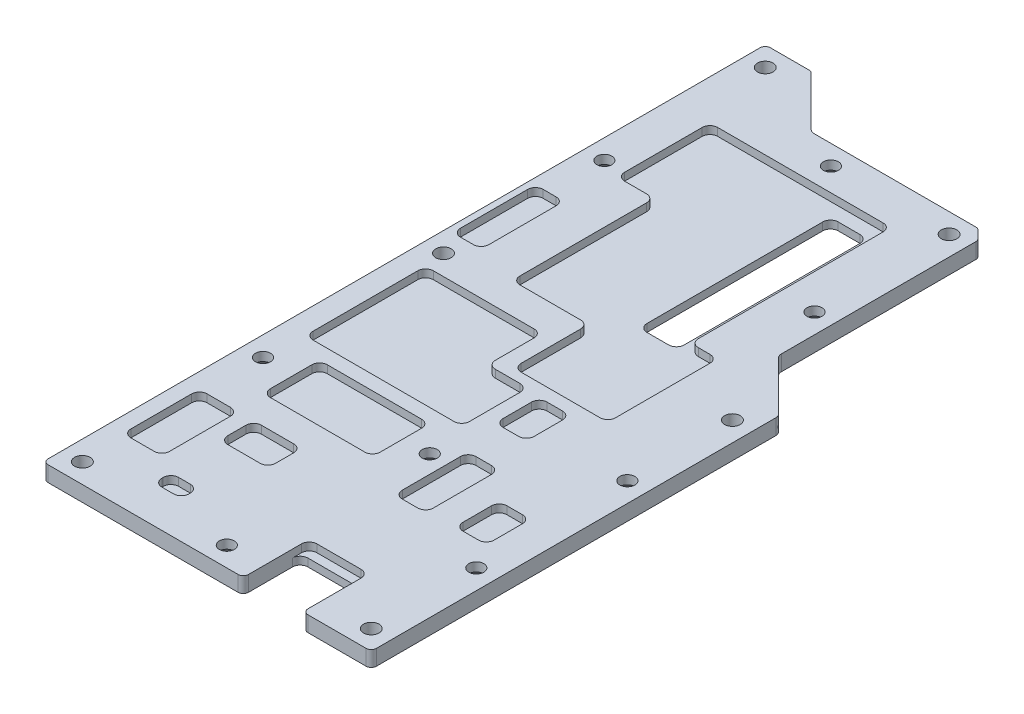
from build123d import *

# Parameters (mm, degrees)
BOSS_EXTRUDE1_DEPTH                                  = 3
CUT_EXTRUDE1_DEPTH                                   = 1.5
CUT_EXTRUDE2_REACH                                   = 155.484
F_3_0MM_DOWEL_HOLE1_D                                = 3
CSK_FOR_M2_5_COUNTERSUNK_RAISED_HEAD_SCR_D           = 2.9
CSK_FOR_M2_5_COUNTERSUNK_RAISED_HEAD_SCR_CSINK_D     = 5.5
CSK_FOR_M2_5_COUNTERSUNK_RAISED_HEAD_SCR_CSINK_ANGLE = 90


with BuildPart() as part:
    # Sketch1 → Boss-Extrude1 (new body)
    with BuildSketch(Plane(origin=(0, 0, 0), x_dir=(1, 0, 0), z_dir=(0, 1, 0))):
        with BuildLine():
            Line((0, 1), (0, 138.7))
            ThreePointArc((0, 138.7), (0.292893219, 139.407106781), (1, 139.7))
            Line((1, 139.7), (8.475786438, 139.7))
            ThreePointArc((8.475786438, 139.7), (8.85846987, 139.623879533), (9.182893219, 139.407106781))
            Line((9.182893219, 139.407106781), (18.610660172, 129.979339828))
            ThreePointArc((18.610660172, 129.979339828), (19.097295195, 129.654180701), (19.671320344, 129.54))
            Line((19.671320344, 129.54), (50.895786438, 129.54))
            ThreePointArc((50.895786438, 129.54), (51.27846987, 129.463879533), (51.602893219, 129.247106781))
            Line((51.602893219, 129.247106781), (53.047106781, 127.802893219))
            ThreePointArc((53.047106781, 127.802893219), (53.263879533, 127.47846987), (53.34, 127.095786438))
            Line((53.34, 127.095786438), (53.34, 89.521320344))
            ThreePointArc((53.34, 89.521320344), (53.454180701, 88.947295195), (53.779339828, 88.460660172))
            Line((53.779339828, 88.460660172), (63.207106781, 79.032893219))
            ThreePointArc((63.207106781, 79.032893219), (63.423879533, 78.70846987), (63.5, 78.325786438))
            Line((63.5, 78.325786438), (63.5, 1))
            ThreePointArc((63.5, 1), (63.207106781, 0.292893219), (62.5, 0))
            Line((62.5, 0), (51.25, 0))
            ThreePointArc((51.25, 0), (50.542893219, 0.292893219), (50.25, 1))
            Line((50.25, 1), (50.25, 9.5))
            ThreePointArc((50.25, 9.5), (49.810660172, 10.560660172), (48.75, 11))
            Line((48.75, 11), (40.25, 11))
            ThreePointArc((40.25, 11), (39.189339828, 10.560660172), (38.75, 9.5))
            Line((38.75, 9.5), (38.75, 1))
            ThreePointArc((38.75, 1), (38.457106781, 0.292893219), (37.75, 0))
            Line((37.75, 0), (1, 0))
            ThreePointArc((1, 0), (0.292893219, 0.292893219), (0, 1))
        make_face()
    extrude(amount=BOSS_EXTRUDE1_DEPTH)

    # Sketch2 → Cut-Extrude1 (cut)
    with BuildSketch(Plane(origin=(0, 3, 0), x_dir=(1, 0, 0), z_dir=(0, 1, 0))):
        with BuildLine():
            Line((50.25, 0), (50.25, 11.25))
            ThreePointArc((50.25, 11.25), (49.810660172, 12.310660172), (48.75, 12.75))
            Line((48.75, 12.75), (40.25, 12.75))
            ThreePointArc((40.25, 12.75), (39.189339828, 12.310660172), (38.75, 11.25))
            Line((38.75, 11.25), (38.75, 0))
            Line((38.75, 0), (50.25, 0))
        make_face()
        with BuildLine():
            Line((52.25, 37.5), (55.25, 37.5))
            ThreePointArc((55.25, 37.5), (56.310660172, 37.060660172), (56.75, 36))
            Line((56.75, 36), (56.75, 30.5))
            ThreePointArc((56.75, 30.5), (56.310660172, 29.439339828), (55.25, 29))
            Line((55.25, 29), (52.25, 29))
            ThreePointArc((52.25, 29), (51.189339828, 29.439339828), (50.75, 30.5))
            Line((50.75, 30.5), (50.75, 36))
            ThreePointArc((50.75, 36), (51.189339828, 37.060660172), (52.25, 37.5))
        make_face()
        with BuildLine():
            Line((41, 42.75), (44, 42.75))
            ThreePointArc((44, 42.75), (45.060660172, 42.310660172), (45.5, 41.25))
            Line((45.5, 41.25), (45.5, 30))
            ThreePointArc((45.5, 30), (45.060660172, 28.939339828), (44, 28.5))
            Line((44, 28.5), (41, 28.5))
            ThreePointArc((41, 28.5), (39.939339828, 28.939339828), (39.5, 30))
            Line((39.5, 30), (39.5, 41.25))
            ThreePointArc((39.5, 41.25), (39.939339828, 42.310660172), (41, 42.75))
        make_face()
        with BuildLine():
            Line((11.25, 43.75), (29.5, 43.75))
            ThreePointArc((29.5, 43.75), (30.560660172, 43.310660172), (31, 42.25))
            Line((31, 42.25), (31, 34.25))
            ThreePointArc((31, 34.25), (30.560660172, 33.189339828), (29.5, 32.75))
            Line((29.5, 32.75), (11.25, 32.75))
            ThreePointArc((11.25, 32.75), (10.189339828, 33.189339828), (9.75, 34.25))
            Line((9.75, 34.25), (9.75, 42.25))
            ThreePointArc((9.75, 42.25), (10.189339828, 43.310660172), (11.25, 43.75))
        make_face()
        with BuildLine():
            Line((18, 10.5), (15.75, 10.5))
            ThreePointArc((15.75, 10.5), (14.689339828, 10.060660172), (14.25, 9))
            Line((14.25, 9), (14.25, 8.75))
            ThreePointArc((14.25, 8.75), (14.689339828, 7.689339828), (15.75, 7.25))
            Line((15.75, 7.25), (18, 7.25))
            ThreePointArc((18, 7.25), (19.060660172, 7.689339828), (19.5, 8.75))
            Line((19.5, 8.75), (19.5, 9))
            ThreePointArc((19.5, 9), (19.060660172, 10.060660172), (18, 10.5))
        make_face()
        with BuildLine():
            Line((4.25, 68.25), (4.25, 48))
            ThreePointArc((4.25, 48), (4.689339828, 46.939339828), (5.75, 46.5))
            Line((5.75, 46.5), (33, 46.5))
            ThreePointArc((33, 46.5), (34.060660172, 46.939339828), (34.5, 48))
            Line((34.5, 48), (34.5, 57.75))
            ThreePointArc((34.5, 57.75), (34.060660172, 58.810660172), (33, 59.25))
            Line((33, 59.25), (28.25, 59.25))
            ThreePointArc((28.25, 59.25), (27.189339828, 59.689339828), (26.75, 60.75))
            Line((26.75, 60.75), (26.75, 68.25))
            ThreePointArc((26.75, 68.25), (26.310660172, 69.310660172), (25.25, 69.75))
            Line((25.25, 69.75), (5.75, 69.75))
            ThreePointArc((5.75, 69.75), (4.689339828, 69.310660172), (4.25, 68.25))
        make_face()
        with BuildLine():
            Line((4.5, 27.25), (9, 27.25))
            ThreePointArc((9, 27.25), (10.060660172, 26.810660172), (10.5, 25.75))
            Line((10.5, 25.75), (10.5, 14))
            ThreePointArc((10.5, 14), (10.060660172, 12.939339828), (9, 12.5))
            Line((9, 12.5), (4.5, 12.5))
            ThreePointArc((4.5, 12.5), (3.439339828, 12.939339828), (3, 14))
            Line((3, 14), (3, 25.75))
            ThreePointArc((3, 25.75), (3.439339828, 26.810660172), (4.5, 27.25))
        make_face()
        with BuildLine():
            Line((15, 27.25), (21.25, 27.25))
            ThreePointArc((21.25, 27.25), (22.310660172, 26.810660172), (22.75, 25.75))
            Line((22.75, 25.75), (22.75, 22.25))
            ThreePointArc((22.75, 22.25), (22.310660172, 21.189339828), (21.25, 20.75))
            Line((21.25, 20.75), (15, 20.75))
            ThreePointArc((15, 20.75), (13.939339828, 21.189339828), (13.5, 22.25))
            Line((13.5, 22.25), (13.5, 25.75))
            ThreePointArc((13.5, 25.75), (13.939339828, 26.810660172), (15, 27.25))
        make_face()
        with BuildLine():
            Line((31.25, 61.25), (46.5, 61.25))
            ThreePointArc((46.5, 61.25), (47.560660172, 61.689339828), (48, 62.75))
            Line((48, 62.75), (48, 81))
            ThreePointArc((48, 81), (47.560660172, 82.060660172), (46.5, 82.5))
            Line((46.5, 82.5), (44.25, 82.5))
            ThreePointArc((44.25, 82.5), (43.189339828, 82.939339828), (42.75, 84))
            Line((42.75, 84), (42.75, 119.75))
            ThreePointArc((42.75, 119.75), (42.310660172, 120.810660172), (41.25, 121.25))
            Line((41.25, 121.25), (9.25, 121.25))
            ThreePointArc((9.25, 121.25), (8.189339828, 120.810660172), (7.75, 119.75))
            Line((7.75, 119.75), (7.75, 104.75))
            ThreePointArc((7.75, 104.75), (8.189339828, 103.689339828), (9.25, 103.25))
            Line((9.25, 103.25), (13.5, 103.25))
            ThreePointArc((13.5, 103.25), (14.560660172, 102.810660172), (15, 101.75))
            Line((15, 101.75), (15, 77.25))
            ThreePointArc((15, 77.25), (15.439339828, 76.189339828), (16.5, 75.75))
            Line((16.5, 75.75), (28.25, 75.75))
            ThreePointArc((28.25, 75.75), (29.310660172, 75.310660172), (29.75, 74.25))
            Line((29.75, 74.25), (29.75, 62.75))
            ThreePointArc((29.75, 62.75), (30.189339828, 61.689339828), (31.25, 61.25))
        make_face()
        with BuildLine():
            Line((38.75, 58.75), (41.75, 58.75))
            ThreePointArc((41.75, 58.75), (42.810660172, 58.310660172), (43.25, 57.25))
            Line((43.25, 57.25), (43.25, 51.75))
            ThreePointArc((43.25, 51.75), (42.810660172, 50.689339828), (41.75, 50.25))
            Line((41.75, 50.25), (38.75, 50.25))
            ThreePointArc((38.75, 50.25), (37.689339828, 50.689339828), (37.25, 51.75))
            Line((37.25, 51.75), (37.25, 57.25))
            ThreePointArc((37.25, 57.25), (37.689339828, 58.310660172), (38.75, 58.75))
        make_face()
        with BuildLine():
            Line((2.75, 94), (5.25, 94))
            ThreePointArc((5.25, 94), (6.310660172, 93.560660172), (6.75, 92.5))
            Line((6.75, 92.5), (6.75, 79.5))
            ThreePointArc((6.75, 79.5), (6.310660172, 78.439339828), (5.25, 78))
            Line((5.25, 78), (2.75, 78))
            ThreePointArc((2.75, 78), (1.689339828, 78.439339828), (1.25, 79.5))
            Line((1.25, 79.5), (1.25, 92.5))
            ThreePointArc((1.25, 92.5), (1.689339828, 93.560660172), (2.75, 94))
        make_face()
    extrude(amount=-CUT_EXTRUDE1_DEPTH, mode=Mode.SUBTRACT)

    # Sketch3 → Cut-Extrude2 (cut, up to next)
    with BuildSketch(Plane(origin=(0, 0, 0), x_dir=(-1, 0, 0), z_dir=(0, -1, 0)), mode=Mode.PRIVATE) as cut_extrude2_sk1:
        with BuildLine():
            Line((-39.44, 118.58), (-35.24, 118.58))
            ThreePointArc((-35.24, 118.58), (-34.179339828, 118.140660172), (-33.74, 117.08))
            Line((-33.74, 117.08), (-33.74, 83.08))
            ThreePointArc((-33.74, 83.08), (-34.179339828, 82.019339828), (-35.24, 81.58))
            Line((-35.24, 81.58), (-39.44, 81.58))
            ThreePointArc((-39.44, 81.58), (-40.500660172, 82.019339828), (-40.94, 83.08))
            Line((-40.94, 83.08), (-40.94, 117.08))
            ThreePointArc((-40.94, 117.08), (-40.500660172, 118.140660172), (-39.44, 118.58))
        make_face()
    cut_extrude2_tool1 = extrude(cut_extrude2_sk1.sketch, amount=-CUT_EXTRUDE2_REACH, mode=Mode.PRIVATE) & part.part
    add(cut_extrude2_tool1.solids().sort_by_distance((37.34, 0, -100.08))[0], mode=Mode.SUBTRACT)

    # Ø3.0mm Dowel Hole1 (through all)
    with Locations(Plane(origin=(0, 3, 0), x_dir=(1, 0, 0), z_dir=(0, 1, 0))):
        with Locations((3.81, 135.89), (49.53, 125.73), (59.69, 73.66), (59.69, 3.81), (3.81, 3.81), (3.81, 73.66)):
            Hole(F_3_0MM_DOWEL_HOLE1_D / 2)

    # CSK for M2.5 Countersunk Raised Head Screw1 (through all)
    with Locations(Plane(origin=(0, 0, 0), x_dir=(-1, 0, 0), z_dir=(0, -1, 0))):
        with Locations((-26.67, 125.73), (-31.75, 3.81), (-59.69, 53.34), (-3.81, 38.74), (-36.07, 38.74), (-59.69, 24.13), (-49.53, 99.69), (-3.81, 104.77)):
            CounterSinkHole(CSK_FOR_M2_5_COUNTERSUNK_RAISED_HEAD_SCR_D / 2, CSK_FOR_M2_5_COUNTERSUNK_RAISED_HEAD_SCR_CSINK_D / 2, counter_sink_angle=CSK_FOR_M2_5_COUNTERSUNK_RAISED_HEAD_SCR_CSINK_ANGLE)


solid = part.part
